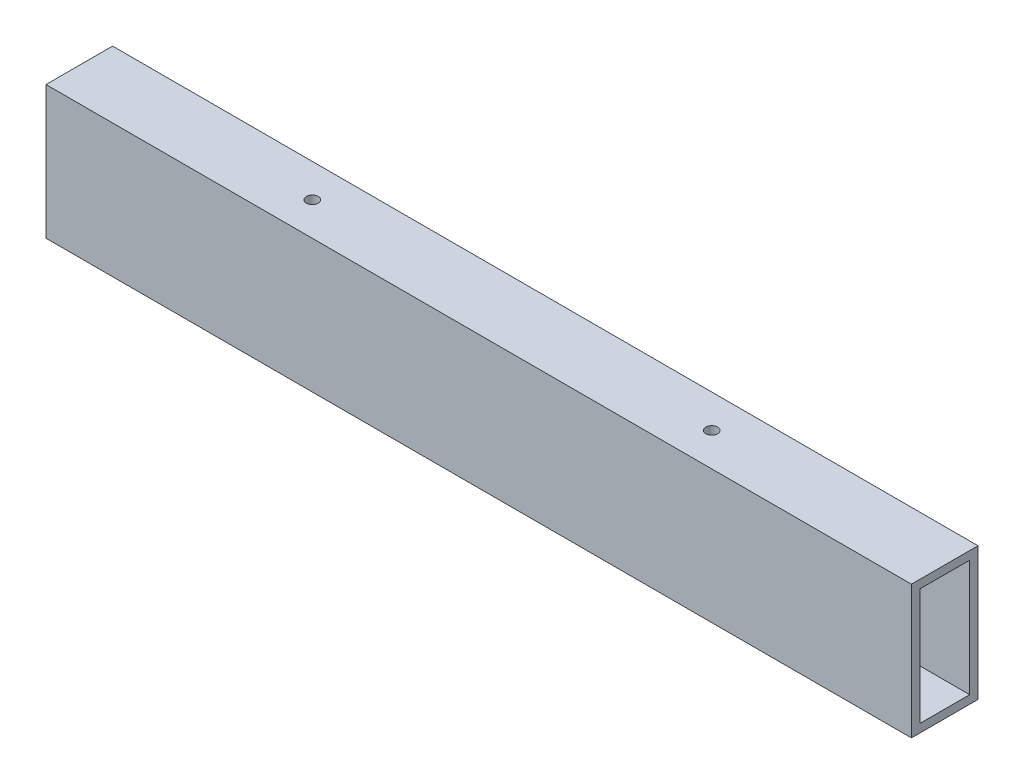
from build123d import *

# Parameters (mm, degrees)
SKETCH1_W            = 25.4
SKETCH1_H            = 50.8
SKETCH1_W_2          = 19.05
SKETCH1_H_2          = 44.45
BOSS_EXTRUDE1_DEPTH  = 330.2
M3_CLEARANCE_HOLE6_D = 4.5


with BuildPart() as part:
    # Sketch1 → Boss-Extrude1 (new body)
    with BuildSketch(Plane(origin=(0, 0, 0), x_dir=(0, 0, -1), z_dir=(1, 0, 0))):
        Rectangle(SKETCH1_W, SKETCH1_H)
        Rectangle(SKETCH1_W_2, SKETCH1_H_2, mode=Mode.SUBTRACT)
    extrude(amount=BOSS_EXTRUDE1_DEPTH)

    # M3 Clearance Hole6 (through all)
    with Locations(Plane(origin=(88.9, -25.4, 0), x_dir=(0, 0, -1), z_dir=(0, -1, 0))):
        with Locations((0, 0), (0, 152.4)):
            Hole(M3_CLEARANCE_HOLE6_D / 2)


solid = part.part
